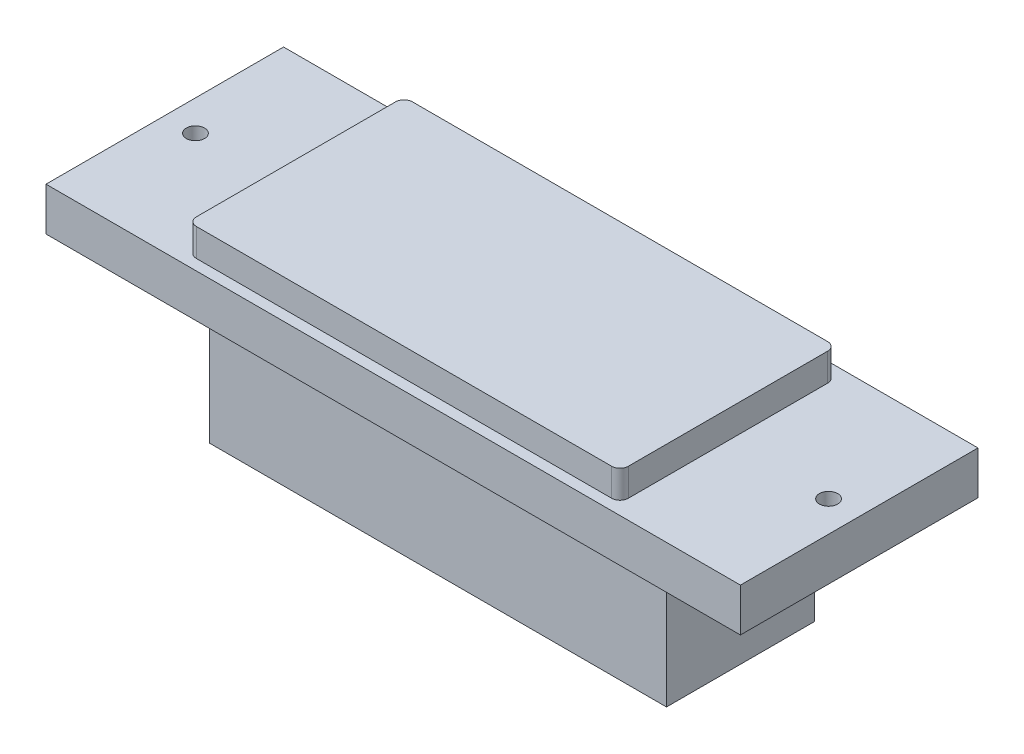
from build123d import *

# Parameters (mm, degrees)
SKETCH1_W             = 66.04
SKETCH1_H             = 33.02
BOSS_EXTRUDE1_DEPTH   = 4.2418
FILLET1_R             = 1.27
SKETCH2_W             = 106.172
SKETCH2_H             = 36.322
BOSS_EXTRUDE2_DEPTH   = 6.604
F_3_CLEARANCE_HOLE1_D = 2.794
SKETCH6_W             = 69.85
SKETCH6_H             = 22.606
BOSS_EXTRUDE3_DEPTH   = 22.0472


with BuildPart() as part:
    # Sketch1 → Boss-Extrude1 (new body)
    with BuildSketch(Plane(origin=(0, 0, 0), x_dir=(1, 0, 0), z_dir=(0, 1, 0))):
        Rectangle(SKETCH1_W, SKETCH1_H)
    extrude(amount=BOSS_EXTRUDE1_DEPTH)

    # Fillet1
    fillet1_edges = [part.edges().sort_by_distance(p)[0] for p in [
        (33.02, 2.1209, 16.51),
        (33.02, 2.1209, -16.51),
        (-33.02, 2.1209, -16.51),
        (-33.02, 2.1209, 16.51),
    ]]
    fillet(fillet1_edges, radius=FILLET1_R)

    # Sketch2 → Boss-Extrude2 (add)
    with BuildSketch(Plane.XZ):
        Rectangle(SKETCH2_W, SKETCH2_H)
    extrude(amount=BOSS_EXTRUDE2_DEPTH)

    # #3 Clearance Hole1 (through all)
    with Locations(Plane(origin=(0, 0, 0), x_dir=(1, 0, 0), z_dir=(0, 1, 0))):
        with Locations((-48.3997, 0), (48.3997, 0)):
            Hole(F_3_CLEARANCE_HOLE1_D / 2)

    # Sketch6 → Boss-Extrude3 (add)
    with BuildSketch(Plane.XZ.offset(6.604)):
        Rectangle(SKETCH6_W, SKETCH6_H)
    extrude(amount=BOSS_EXTRUDE3_DEPTH)


solid = part.part
